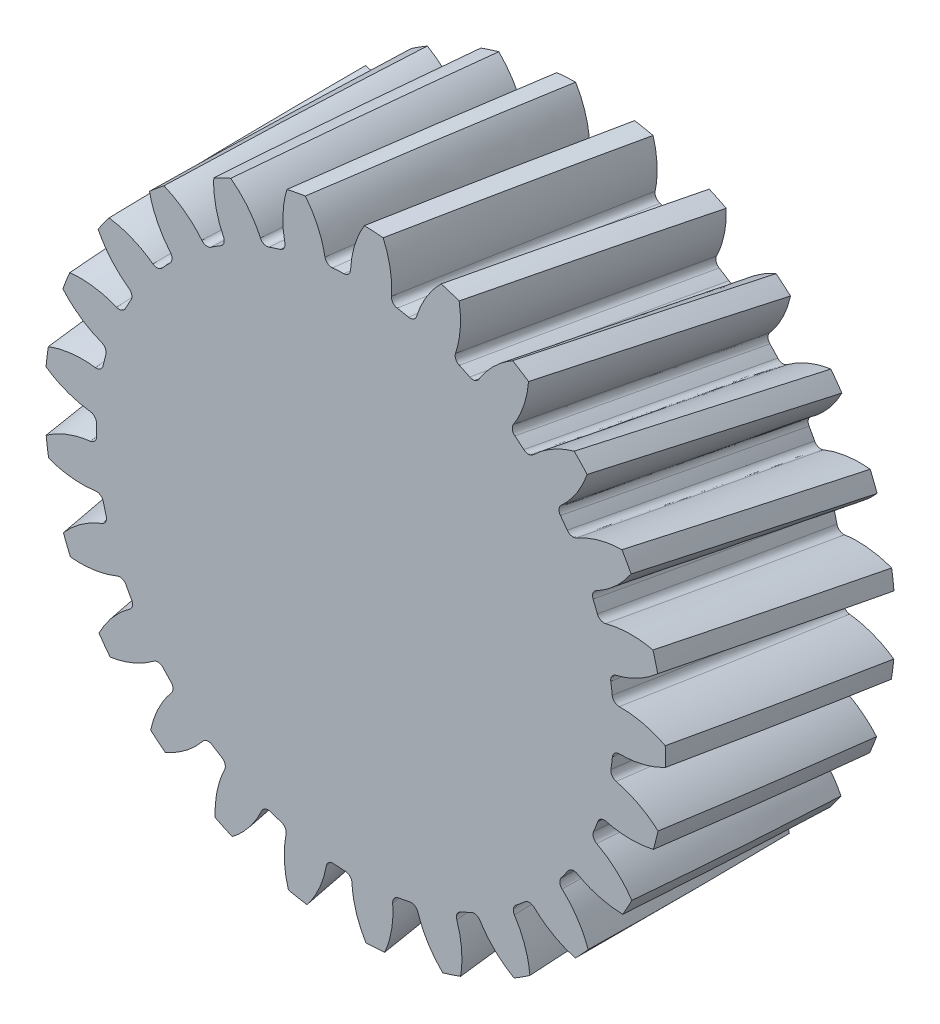
from build123d import *

# Parameters (mm, degrees)
SKETCH1_R                = 27
BOSS_EXTRUDE1_DEPTH      = 10
FILLET1_R                = 0.6
CIRPATTERN2_COUNT        = 25
FILLET1_OF_CIRPATTERN2_R = 0.6


with BuildPart() as part:
    # Sketch1 → Boss-Extrude1 (new, symmetric)
    with BuildSketch(Plane.XY):
        Circle(SKETCH1_R)
    extrude(amount=BOSS_EXTRUDE1_DEPTH, both=True)

    # Sketch4 for Cut-Loft1 → Cut-Loft1 section 0
    with BuildSketch(Plane(origin=(0, 0, 10), x_dir=(0.9978652657534929, 0.06530628915128346, 0), z_dir=(0, 0, 1))):
        with BuildLine():
            # circular arc as an exact rational Bezier (weights 1, cos(half-angle), 1)
            Bezier((-3.31531694, 27.803033532), (-1.218687107, 25.549200535), (-1.072022538, 22.474446994), weights=[1, 0.939095418, 1])
            Bezier((-1.072022538, 22.474446994), (0, 22.525582059), (1.072022538, 22.474446994), weights=[1, 0.998864311, 1])
            Bezier((1.072022538, 22.474446994), (1.218687107, 25.549200535), (3.31531694, 27.803033532), weights=[1, 0.939095418, 1])
            Bezier((3.31531694, 27.803033532), (0, 28.198361848), (-3.31531694, 27.803033532), weights=[1, 0.992965483, 1])
        make_face()
    # Sketch2 for Cut-Loft1 → Cut-Loft1 section 1
    with BuildSketch(Plane.XY):
        with BuildLine():
            Bezier((-3.31531694, 27.803033532), (-1.218687107, 25.549200535), (-1.072022538, 22.474446994), weights=[1, 0.939095418, 1])
            Bezier((-1.072022538, 22.474446994), (0, 22.525582059), (1.072022538, 22.474446994), weights=[1, 0.998864311, 1])
            Bezier((1.072022538, 22.474446994), (1.218687107, 25.549200535), (3.31531694, 27.803033532), weights=[1, 0.939095418, 1])
            Bezier((3.31531694, 27.803033532), (0, 28.198361848), (-3.31531694, 27.803033532), weights=[1, 0.992965483, 1])
        make_face()
    # Sketch5 for Cut-Loft1 → Cut-Loft1 section 2
    with BuildSketch(Plane(origin=(0, 0, -10), x_dir=(0.9978652657534929, -0.06530628915128359, 0), z_dir=(0, 0, 1))):
        with BuildLine():
            Bezier((-3.31531694, 27.803033532), (-1.218687107, 25.549200535), (-1.072022538, 22.474446994), weights=[1, 0.939095418, 1])
            Bezier((-1.072022538, 22.474446994), (0, 22.525582059), (1.072022538, 22.474446994), weights=[1, 0.998864311, 1])
            Bezier((1.072022538, 22.474446994), (1.218687107, 25.549200535), (3.31531694, 27.803033532), weights=[1, 0.939095418, 1])
            Bezier((3.31531694, 27.803033532), (0, 28.198361848), (-3.31531694, 27.803033532), weights=[1, 0.992965483, 1])
        make_face()
    cut_loft1 = loft(mode=Mode.SUBTRACT)

    # Fillet1
    fillet1_edges = [part.edges().sort_by_distance(p)[0] for p in [
        (-1.072022538, 22.474446994, 0),
        (1.072022538, 22.474446994, 0),
    ]]
    fillet(fillet1_edges, radius=FILLET1_R)

    # CirPattern2: Cut-Loft1 ×25 about axis
    cirpattern2_axis = Axis((0, 0, 10), (0, 0, -1))
    for i in range(1, CIRPATTERN2_COUNT):
        add(cut_loft1.rotate(cirpattern2_axis, i * 360 / CIRPATTERN2_COUNT), mode=Mode.SUBTRACT)

    # Fillet1 of CirPattern2
    fillet1_of_cirpattern2_edges = [part.edges().sort_by_distance(p)[0] for p in [
        (4.550824708, 22.034972078, 0),
        (6.627510666, 21.50176975, 0),
        (9.887726902, 20.210958827, 0),
        (11.766567924, 19.178057235, 0),
        (14.603346849, 17.117016703, 0),
        (16.166288445, 15.649316851, 0),
        (18.401384806, 12.947549467, 0),
        (19.550221608, 11.137272336, 0),
        (21.043196081, 7.964540081, 0),
        (21.705742446, 5.92543204, 0),
        (22.362785954, 2.481089349, 0),
        (22.497411659, 0.341275057, 0),
        (22.277239742, -3.158257351, 0),
        (21.875485757, -5.264325494, 0),
        (20.791932626, -8.599159126, 0),
        (19.879042632, -10.539149113, 0),
        (18.000191916, -13.499744108, 0),
        (16.63352615, -15.151759232, 0),
        (14.077432948, -17.552090519, 0),
        (12.342864045, -18.812328595, 0),
        (9.270137095, -20.501574531, 0),
        (7.276654398, -21.290850165, 0),
        (3.880364434, -22.162869215, 0),
        (1.753225794, -22.431589318, 0),
        (-1.753225794, -22.431589318, 0),
        (-3.880364434, -22.162869215, 0),
        (-7.276654398, -21.290850165, 0),
        (-9.270137095, -20.501574531, 0),
        (-12.342864045, -18.812328595, 0),
        (-14.077432948, -17.552090519, 0),
        (-16.63352615, -15.151759232, 0),
        (-18.000191916, -13.499744108, 0),
        (-19.879042632, -10.539149113, 0),
        (-20.791932626, -8.599159126, 0),
        (-21.875485757, -5.264325494, 0),
        (-22.277239742, -3.158257351, 0),
        (-22.497411659, 0.341275057, 0),
        (-22.362785954, 2.481089349, 0),
        (-21.705742446, 5.92543204, 0),
        (-21.043196081, 7.964540081, 0),
        (-19.550221608, 11.137272336, 0),
        (-18.401384806, 12.947549467, 0),
        (-16.166288445, 15.649316851, 0),
        (-14.603346849, 17.117016703, 0),
        (-11.766567924, 19.178057235, 0),
        (-9.887726902, 20.210958827, 0),
        (-6.627510666, 21.50176975, 0),
        (-4.550824708, 22.034972078, 0),
    ]]
    fillet(fillet1_of_cirpattern2_edges, radius=FILLET1_OF_CIRPATTERN2_R)


solid = part.part
